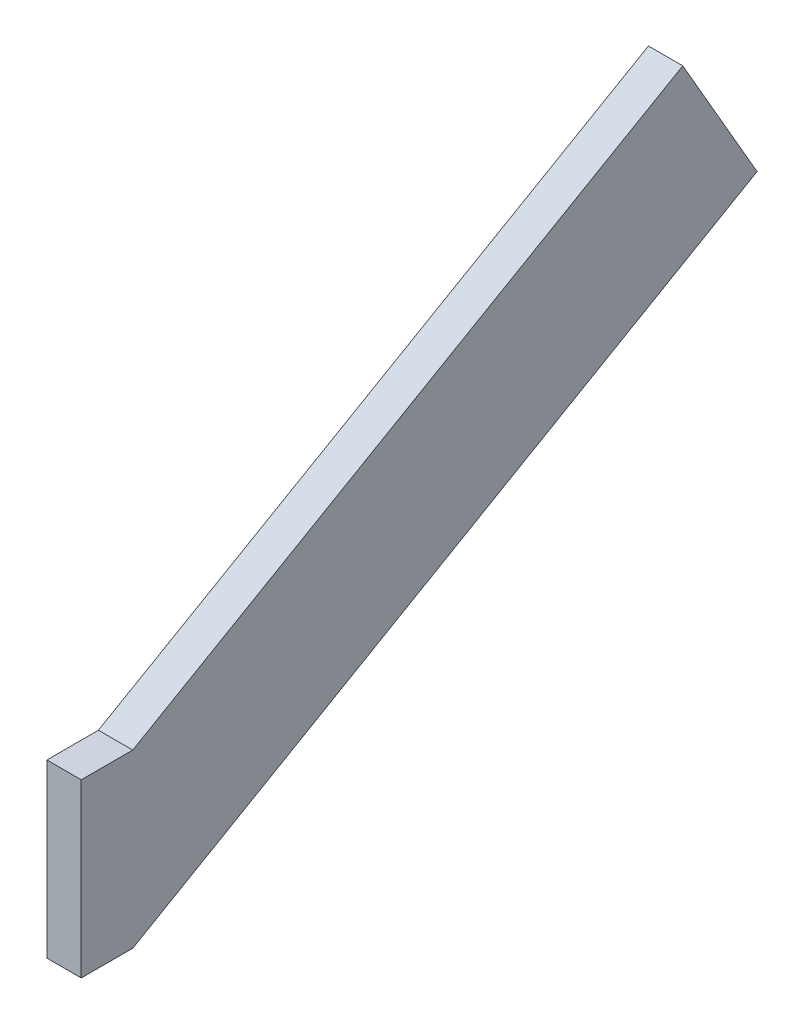
from build123d import *

# Parameters (mm, degrees)
SALIENTE_EXTRUIR1_DEPTH = 10


with BuildPart() as part:
    # Croquis1 → Saliente-Extruir1 (new body)
    with BuildSketch(Plane(origin=(0, 0, 0), x_dir=(0, 0, -1), z_dir=(1, 0, 0))):
        Polygon((0, 0), (0, 50), (15, 50), (175.2146997, 142.5), (196.865334795, 105), (15, 0), align=None)
    extrude(amount=SALIENTE_EXTRUIR1_DEPTH)


solid = part.part
